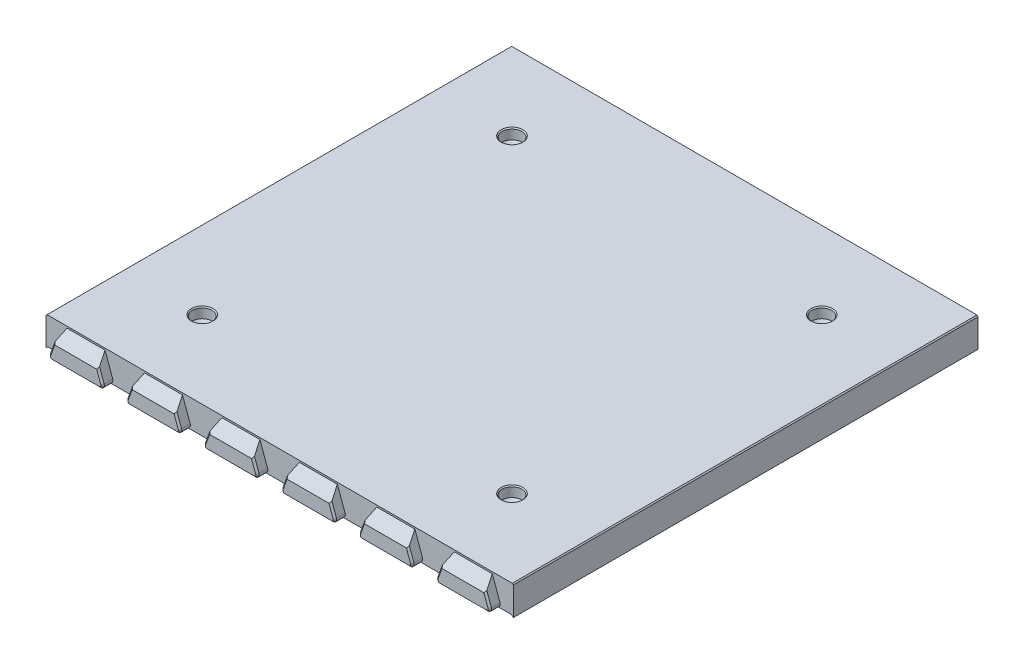
from build123d import *

# Parameters (mm, degrees)
BOSS_EXTRUDE1_DEPTH             = 67.5
SKETCH7_W                       = 131.75
SKETCH7_H                       = 6
BOSS_EXTRUDE7_DEPTH             = 1
BOSS_EXTRUDE4_DEPTH             = 3
BOSS_EXTRUDE8_REACH             = 98.059
BOSS_EXTRUDE8_DIRECTION_2_DEPTH = 2
CHAMFER4_SIZE                   = 0.5
FILLET4_R                       = 1
CHAMFER6_SIZE                   = 0.5
FILLET2_R                       = 2
CHAMFER4_OF_MIRROR2_SIZE        = 0.5
FILLET4_OF_MIRROR2_R            = 1
CHAMFER6_OF_MIRROR2_SIZE        = 0.5
FILLET2_OF_MIRROR2_R            = 2
BOSS_EXTRUDE9_REACH             = 155.997
SKETCH9_R                       = 5
FILLET3_R                       = 3
SKETCH10_R                      = 1.85
CUT_EXTRUDE2_DEPTH              = 154.996803944
SKETCH11_R                      = 2.85
CUT_EXTRUDE3_DEPTH              = 3
CHAMFER7_SIZE                   = 1
CUT_EXTRUDE4_DEPTH              = 154.996803944
CUT_EXTRUDE4_DEPTH_BACK         = 154.996803944
BOSS_EXTRUDE10_DEPTH            = 135
CHAMFER8_SIZE                   = 0.3


with BuildPart() as part:
    # Sketch1 → Boss-Extrude1 (new body)
    with BuildSketch(Plane.XY):
        Polygon((-67.875, 0), (-67.875, 8), (67.875, 8), (67.875, 0), (65.875, 0), (65.875, 6), (-65.875, 6), (-65.875, 0), align=None)
    boss_extrude1 = extrude(amount=-BOSS_EXTRUDE1_DEPTH)

    # Sketch7 → Boss-Extrude7 (add)
    with BuildSketch(Plane.XY):
        with Locations((0, 3)):
            Rectangle(SKETCH7_W, SKETCH7_H)
    boss_extrude7 = extrude(amount=-BOSS_EXTRUDE7_DEPTH)

    # Sketch2 → Boss-Extrude4 (add)
    with BuildSketch(Plane.XY):
        Polygon((50.911761874, 8), (48, 0), (64.5, 0), (61.588238126, 8), align=None)
        Polygon((28.411761874, 8), (25.5, 0), (42, 0), (39.088238126, 8), align=None)
        Polygon((5.911761874, 8), (3, 0), (19.5, 0), (16.588238126, 8), align=None)
        Polygon((-16.588238126, 8), (-19.5, 0), (-3, 0), (-5.911761874, 8), align=None)
        Polygon((-39.088238126, 8), (-42, 0), (-25.5, 0), (-28.411761874, 8), align=None)
        Polygon((-61.588238126, 8), (-64.5, 0), (-48, 0), (-50.911761874, 8), align=None)
    boss_extrude4 = extrude(amount=BOSS_EXTRUDE4_DEPTH)

    # Sketch8 → Boss-Extrude8 (add, up to next)
    with BuildSketch(Plane.XZ, mode=Mode.PRIVATE) as boss_extrude8_sk1:
        Polygon((-66.35, -24.741658736), (-62.65, -23.394968869), (-62.65, -21.605031131), (-66.35, -20.258341264), align=None)
    boss_extrude8_tool1 = extrude(boss_extrude8_sk1.sketch, amount=-BOSS_EXTRUDE8_REACH, mode=Mode.PRIVATE) - part.part
    # Sketch8 → Boss-Extrude8 (add, up to next)
    with BuildSketch(Plane.XZ, mode=Mode.PRIVATE) as boss_extrude8_sk2:
        Polygon((-66.35, -65.258341264), (-62.65, -66.605031131), (-62.65, -67.35), (-62.65, -67.5), (-66.35, -67.5), (-66.35, -67.35), align=None)
    boss_extrude8_tool2 = extrude(boss_extrude8_sk2.sketch, amount=-BOSS_EXTRUDE8_REACH, mode=Mode.PRIVATE) - part.part
    # Sketch8 → Boss-Extrude8 (add, up to next)
    with BuildSketch(Plane.XZ, mode=Mode.PRIVATE) as boss_extrude8_sk3:
        Polygon((66.35, -24.741658736), (66.35, -20.258341264), (62.65, -21.605031131), (62.65, -23.394968869), align=None)
    boss_extrude8_tool3 = extrude(boss_extrude8_sk3.sketch, amount=-BOSS_EXTRUDE8_REACH, mode=Mode.PRIVATE) - part.part
    # Sketch8 → Boss-Extrude8 (add, up to next)
    with BuildSketch(Plane.XZ, mode=Mode.PRIVATE) as boss_extrude8_sk4:
        Polygon((66.35, -67.5), (62.65, -67.5), (62.65, -67.35), (62.65, -66.605031131), (66.35, -65.258341264), (66.35, -67.35), align=None)
    boss_extrude8_tool4 = extrude(boss_extrude8_sk4.sketch, amount=-BOSS_EXTRUDE8_REACH, mode=Mode.PRIVATE) - part.part
    boss_extrude8_1 = boss_extrude8_tool1.solids().sort_by_distance((-64.764762, 0, -22.5))[0]
    add(boss_extrude8_1)
    boss_extrude8_2 = boss_extrude8_tool2.solids().sort_by_distance((-64.764762, 0, -66.66766))[0]
    add(boss_extrude8_2)
    boss_extrude8_3 = boss_extrude8_tool3.solids().sort_by_distance((64.764762, 0, -22.5))[0]
    add(boss_extrude8_3)
    boss_extrude8_4 = boss_extrude8_tool4.solids().sort_by_distance((64.764762, 0, -66.66766))[0]
    add(boss_extrude8_4)
    boss_extrude8 = boss_extrude8_1 + boss_extrude8_2 + boss_extrude8_3 + boss_extrude8_4  # Boss-Extrude8 as one shape, for the pattern or mirror that repeats it

    # Sketch8 → Boss-Extrude8 direction 2 (add)
    with BuildSketch(Plane.XZ):
        Polygon((-66.35, -24.741658736), (-62.65, -23.394968869), (-62.65, -21.605031131), (-66.35, -20.258341264), align=None)
        Polygon((-66.35, -65.258341264), (-62.65, -66.605031131), (-62.65, -67.35), (-62.65, -67.5), (-66.35, -67.5), (-66.35, -67.35), align=None)
        Polygon((66.35, -24.741658736), (66.35, -20.258341264), (62.65, -21.605031131), (62.65, -23.394968869), align=None)
        Polygon((66.35, -67.5), (62.65, -67.5), (62.65, -67.35), (62.65, -66.605031131), (66.35, -65.258341264), (66.35, -67.35), align=None)
    boss_extrude8_direction_2 = extrude(amount=BOSS_EXTRUDE8_DIRECTION_2_DEPTH)

    # Chamfer4
    chamfer4_edges = [part.edges().sort_by_distance(p)[0] for p in [
        (-66.35, -2, -22.5),
        (-64.5, -2, -24.068313803),
        (-62.65, -2, -22.5),
        (-64.5, -2, -20.931686197),
        (-66.35, -2, -66.379170632),
        (-62.65, -2, -67.052515565),
        (-64.5, -2, -65.931686197),
        (66.35, -2, -66.379170632),
        (64.5, -2, -65.931686197),
        (62.65, -2, -67.052515565),
        (62.65, -2, -22.5),
        (64.5, -2, -24.068313803),
        (66.35, -2, -22.5),
        (64.5, -2, -20.931686197),
    ]]
    chamfer(chamfer4_edges, length=CHAMFER4_SIZE)

    # Fillet4
    fillet4_edges = [part.edges().sort_by_distance(p)[0] for p in [
        (-64.5, 0, 1.5),
        (-48, 0, 1.5),
        (48, 0, 1.5),
        (64.5, 0, 1.5),
        (25.5, 0, 1.5),
        (42, 0, 1.5),
        (3, 0, 1.5),
        (19.5, 0, 1.5),
        (-42, 0, 1.5),
        (-25.5, 0, 1.5),
        (-19.5, 0, 1.5),
        (-3, 0, 1.5),
    ]]
    fillet(fillet4_edges, radius=FILLET4_R)

    # Chamfer6
    chamfer6_edges = [part.edges().sort_by_distance(p)[0] for p in [
        (-62.79989137, 4.671010072, 3),
        (62.79989137, 4.671010072, 3),
        (56.25, 0, 3),
        (33.75, 0, 3),
        (11.25, 0, 3),
        (-11.25, 0, 3),
        (-33.75, 0, 3),
        (-56.25, 0, 3),
        (48.608995962, 0.426423564, 3),
        (63.891004038, 0.426423564, 3),
        (40.29989137, 4.671010072, 3),
        (26.108995962, 0.426423564, 3),
        (41.391004038, 0.426423564, 3),
        (17.79989137, 4.671010072, 3),
        (3.608995962, 0.426423564, 3),
        (18.891004038, 0.426423564, 3),
        (-4.70010863, 4.671010072, 3),
        (-18.891004038, 0.426423564, 3),
        (-3.608995962, 0.426423564, 3),
        (-27.20010863, 4.671010072, 3),
        (-41.391004038, 0.426423564, 3),
        (-26.108995962, 0.426423564, 3),
        (-49.70010863, 4.671010072, 3),
        (-63.891004038, 0.426423564, 3),
        (-48.608995962, 0.426423564, 3),
        (49.70010863, 4.671010072, 3),
        (27.20010863, 4.671010072, 3),
        (4.70010863, 4.671010072, 3),
        (-40.29989137, 4.671010072, 3),
        (-17.79989137, 4.671010072, 3),
    ]]
    chamfer(chamfer6_edges, length=CHAMFER6_SIZE)

    # Fillet2
    fillet2_edges = [part.edges().sort_by_distance(p)[0] for p in [
        (-65.875, 6, -10.715613563),
        (-65.875, 3, -24.568772875),
        (-65.875, 3, -20.431227125),
        (-64.2625, 6, -23.981870872),
        (-64.2625, 6, -21.018129128),
        (-62.65, 6, -22.5),
        (-65.875, 6, -45),
        (-65.875, 3, -65.431227125),
        (-62.65, 6, -67.052515565),
        (-64.2625, 6, -66.018129128),
        (65.875, 6, -45),
        (65.875, 3, -65.431227125),
        (64.2625, 6, -66.018129128),
        (62.65, 6, -67.052515565),
        (65.875, 6, -10.715613563),
        (65.875, 3, -24.568772875),
        (65.875, 3, -20.431227125),
        (64.2625, 6, -23.981870872),
        (62.65, 6, -22.5),
        (64.2625, 6, -21.018129128),
        (-65.875, 3, -1),
        (0, 6, -1),
        (65.875, 3, -1),
    ]]
    fillet(fillet2_edges, radius=FILLET2_R)


with BuildPart() as mirror2_1:
    # Mirror2: Boss-Extrude1, Boss-Extrude7, Boss-Extrude4, Boss-Extrude8, Boss-Extrude8 direction 2 across plane
    add(boss_extrude1.mirror(Plane.XY.offset(-67.5)))
    add(boss_extrude7.mirror(Plane.XY.offset(-67.5)))
    add(boss_extrude4.mirror(Plane.XY.offset(-67.5)))
    add(boss_extrude8.mirror(Plane.XY.offset(-67.5)))
    add(boss_extrude8_direction_2.mirror(Plane.XY.offset(-67.5)))

    # Chamfer4 of Mirror2
    chamfer4_of_mirror2_edges = [mirror2_1.edges().sort_by_distance(p)[0] for p in [
        (-66.35, -2, -112.5),
        (-64.5, -2, -110.931686197),
        (-62.65, -2, -112.5),
        (-64.5, -2, -114.068313803),
        (-66.35, -2, -68.620829368),
        (-62.65, -2, -67.947484435),
        (-64.5, -2, -69.068313803),
        (66.35, -2, -68.620829368),
        (64.5, -2, -69.068313803),
        (62.65, -2, -67.947484435),
        (62.65, -2, -112.5),
        (64.5, -2, -110.931686197),
        (66.35, -2, -112.5),
        (64.5, -2, -114.068313803),
    ]]
    chamfer(chamfer4_of_mirror2_edges, length=CHAMFER4_OF_MIRROR2_SIZE)

    # Fillet4 of Mirror2
    fillet4_of_mirror2_edges = [mirror2_1.edges().sort_by_distance(p)[0] for p in [
        (-64.5, 0, -136.5),
        (-48, 0, -136.5),
        (48, 0, -136.5),
        (64.5, 0, -136.5),
        (25.5, 0, -136.5),
        (42, 0, -136.5),
        (3, 0, -136.5),
        (19.5, 0, -136.5),
        (-42, 0, -136.5),
        (-25.5, 0, -136.5),
        (-19.5, 0, -136.5),
        (-3, 0, -136.5),
    ]]
    fillet(fillet4_of_mirror2_edges, radius=FILLET4_OF_MIRROR2_R)

    # Chamfer6 of Mirror2
    chamfer6_of_mirror2_edges = [mirror2_1.edges().sort_by_distance(p)[0] for p in [
        (-62.79989137, 4.671010072, -138),
        (62.79989137, 4.671010072, -138),
        (56.25, 0, -138),
        (33.75, 0, -138),
        (11.25, 0, -138),
        (-11.25, 0, -138),
        (-33.75, 0, -138),
        (-56.25, 0, -138),
        (48.608995962, 0.426423564, -138),
        (63.891004038, 0.426423564, -138),
        (40.29989137, 4.671010072, -138),
        (26.108995962, 0.426423564, -138),
        (41.391004038, 0.426423564, -138),
        (17.79989137, 4.671010072, -138),
        (3.608995962, 0.426423564, -138),
        (18.891004038, 0.426423564, -138),
        (-4.70010863, 4.671010072, -138),
        (-18.891004038, 0.426423564, -138),
        (-3.608995962, 0.426423564, -138),
        (-27.20010863, 4.671010072, -138),
        (-41.391004038, 0.426423564, -138),
        (-26.108995962, 0.426423564, -138),
        (-49.70010863, 4.671010072, -138),
        (-63.891004038, 0.426423564, -138),
        (-48.608995962, 0.426423564, -138),
        (49.70010863, 4.671010072, -138),
        (27.20010863, 4.671010072, -138),
        (4.70010863, 4.671010072, -138),
        (-40.29989137, 4.671010072, -138),
        (-17.79989137, 4.671010072, -138),
    ]]
    chamfer(chamfer6_of_mirror2_edges, length=CHAMFER6_OF_MIRROR2_SIZE)

    # Fillet2 of Mirror2
    fillet2_of_mirror2_edges = [mirror2_1.edges().sort_by_distance(p)[0] for p in [
        (-65.875, 6, -124.284386437),
        (-65.875, 3, -110.431227125),
        (-65.875, 3, -114.568772875),
        (-64.2625, 6, -111.018129128),
        (-64.2625, 6, -113.981870872),
        (-62.65, 6, -112.5),
        (-65.875, 6, -90),
        (-65.875, 3, -69.568772875),
        (-62.65, 6, -67.947484435),
        (-64.2625, 6, -68.981870872),
        (65.875, 6, -90),
        (65.875, 3, -69.568772875),
        (64.2625, 6, -68.981870872),
        (62.65, 6, -67.947484435),
        (65.875, 6, -124.284386437),
        (65.875, 3, -110.431227125),
        (65.875, 3, -114.568772875),
        (64.2625, 6, -111.018129128),
        (62.65, 6, -112.5),
        (64.2625, 6, -113.981870872),
        (-65.875, 3, -134),
        (0, 6, -134),
        (65.875, 3, -134),
    ]]
    fillet(fillet2_of_mirror2_edges, radius=FILLET2_OF_MIRROR2_R)


with BuildPart() as part_1:
    add(part.part)

    # Mirror2 united with what the copies touc: union Mirror2_1
    add(mirror2_1.part)

    # Sketch9 → Boss-Extrude9 (add, up to next)
    with BuildSketch(Plane(origin=(0, 0, 0), x_dir=(1, 0, 0), z_dir=(0, 1, 0)), mode=Mode.PRIVATE) as boss_extrude9_sk1:
        with Locations(Location((-45, 22.5, 0), (0, 0, 90))):
            Circle(SKETCH9_R)
    boss_extrude9_tool1 = extrude(boss_extrude9_sk1.sketch, amount=BOSS_EXTRUDE9_REACH, mode=Mode.PRIVATE) - part_1.part
    # Sketch9 → Boss-Extrude9 (add, up to next)
    with BuildSketch(Plane(origin=(0, 0, 0), x_dir=(1, 0, 0), z_dir=(0, 1, 0)), mode=Mode.PRIVATE) as boss_extrude9_sk2:
        with Locations(Location((45, 22.5, 0), (0, 0, 90))):
            Circle(SKETCH9_R)
    boss_extrude9_tool2 = extrude(boss_extrude9_sk2.sketch, amount=BOSS_EXTRUDE9_REACH, mode=Mode.PRIVATE) - part_1.part
    # Sketch9 → Boss-Extrude9 (add, up to next)
    with BuildSketch(Plane(origin=(0, 0, 0), x_dir=(1, 0, 0), z_dir=(0, 1, 0)), mode=Mode.PRIVATE) as boss_extrude9_sk3:
        with Locations(Location((45, 112.5, 0), (0, 0, 90))):
            Circle(SKETCH9_R)
    boss_extrude9_tool3 = extrude(boss_extrude9_sk3.sketch, amount=BOSS_EXTRUDE9_REACH, mode=Mode.PRIVATE) - part_1.part
    # Sketch9 → Boss-Extrude9 (add, up to next)
    with BuildSketch(Plane(origin=(0, 0, 0), x_dir=(1, 0, 0), z_dir=(0, 1, 0)), mode=Mode.PRIVATE) as boss_extrude9_sk4:
        with Locations(Location((-45, 112.5, 0), (0, 0, 90))):
            Circle(SKETCH9_R)
    boss_extrude9_tool4 = extrude(boss_extrude9_sk4.sketch, amount=BOSS_EXTRUDE9_REACH, mode=Mode.PRIVATE) - part_1.part
    add(boss_extrude9_tool1.solids().sort_by_distance((-45, 0, -22.5))[0])
    add(boss_extrude9_tool2.solids().sort_by_distance((45, 0, -22.5))[0])
    add(boss_extrude9_tool3.solids().sort_by_distance((45, 0, -112.5))[0])
    add(boss_extrude9_tool4.solids().sort_by_distance((-45, 0, -112.5))[0])

    # Fillet3
    fillet3_edges = [part_1.edges().sort_by_distance(p)[0] for p in [
        (45, 6, -17.5),
        (-45, 6, -17.5),
        (-45, 6, -107.5),
        (45, 6, -107.5),
    ]]
    fillet(fillet3_edges, radius=FILLET3_R)

    # Sketch10 → Cut-Extrude2 (cut, through all)
    with BuildSketch(Plane(origin=(0, 0, 0), x_dir=(1, 0, 0), z_dir=(0, 1, 0))):
        with Locations(Location((-45, 112.5, 0), (0, 0, 270))):
            Circle(SKETCH10_R)
        with Locations(Location((-45, 22.5, 0), (0, 0, 270))):
            Circle(SKETCH10_R)
        with Locations(Location((45, 22.5, 0), (0, 0, 270))):
            Circle(SKETCH10_R)
        with Locations(Location((45, 112.5, 0), (0, 0, 270))):
            Circle(SKETCH10_R)
    extrude(amount=CUT_EXTRUDE2_DEPTH, mode=Mode.SUBTRACT)

    # Sketch11 → Cut-Extrude3 (cut)
    with BuildSketch(Plane(origin=(0, 8, 0), x_dir=(1, 0, 0), z_dir=(0, 1, 0))):
        with Locations(Location((-45, 112.5, 0), (0, 0, 270))):
            Circle(SKETCH11_R)
        with Locations(Location((45, 112.5, 0), (0, 0, 270))):
            Circle(SKETCH11_R)
        with Locations(Location((45, 22.5, 0), (0, 0, 270))):
            Circle(SKETCH11_R)
        with Locations(Location((-45, 22.5, 0), (0, 0, 270))):
            Circle(SKETCH11_R)
    extrude(amount=-CUT_EXTRUDE3_DEPTH, mode=Mode.SUBTRACT)

    # Chamfer7
    chamfer7_edges = [part_1.edges().sort_by_distance(p)[0] for p in [
        (-45, 5, -24.35),
        (45, 5, -24.35),
        (45, 5, -114.35),
        (-45, 5, -114.35),
    ]]
    chamfer(chamfer7_edges, length=CHAMFER7_SIZE - 0.0001)  # a hair under: the kernel refuses the full size

    # Sketch12 → Cut-Extrude4 (cut, two sides: drawn at the far end of the back side and taken through both)
    with BuildSketch(Plane(origin=(0, 0, 0), x_dir=(0, 0, -1), z_dir=(1, 0, 0)).offset(-CUT_EXTRUDE4_DEPTH_BACK)):
        Polygon((0, 7.5), (-3, 4.5), (-3, 7.5), (-3, 8), (0, 8), align=None)
        Polygon((138, 4.5), (138, 7.5), (138, 8), (135, 8), (135, 7.5), align=None)
    extrude(amount=CUT_EXTRUDE4_DEPTH + CUT_EXTRUDE4_DEPTH_BACK, mode=Mode.SUBTRACT)

    # Sketch13 → Boss-Extrude10 (add)
    with BuildSketch(Plane(origin=(0, 0, -135), x_dir=(-1, 0, 0), z_dir=(0, 0, -1))):
        Polygon((-67.375, 0), (-67.875, -0.5), (-67.875, 0), align=None)
        Polygon((67.875, 0), (67.375, 0), (67.875, -0.5), align=None)
    extrude(amount=-BOSS_EXTRUDE10_DEPTH)

    # Chamfer8
    chamfer8_edges = [part_1.edges().sort_by_distance(p)[0] for p in [
        (-45, 8, -25.35),
        (45, 8, -25.35),
        (45, 8, -115.35),
        (-45, 8, -115.35),
        (-67.875, 8, -67.5),
        (67.875, 8, -67.5),
    ]]
    chamfer(chamfer8_edges, length=CHAMFER8_SIZE)


solid = part_1.part
